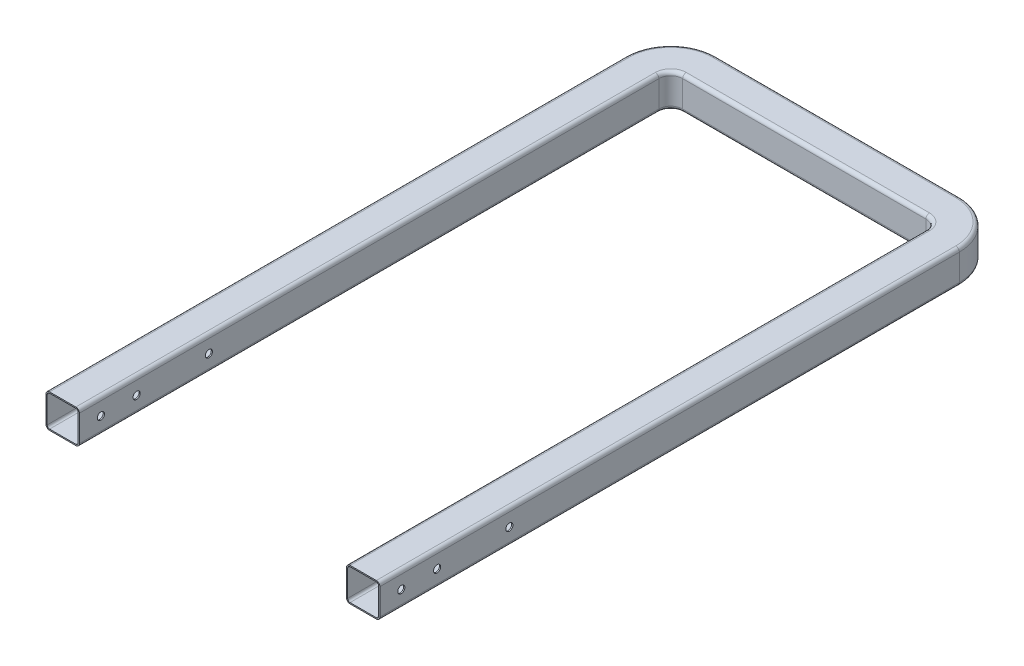
from build123d import *

# Parameters (mm, degrees)
CUT_EXTRUDE2_DEPTH      = 980.716626259
CUT_EXTRUDE2_DEPTH_BACK = 980.716626259
SKETCH4_R               = 5


with BuildPart() as part:
    # Sweep-Thin1: sweep along a path in Sketch1
    with BuildLine(Plane(origin=(0, 0, 0), x_dir=(1, 0, 0), z_dir=(0, 1, 0))) as sweep_thin1_path:
        Line((0, 0), (0, 810))
        ThreePointArc((0, 810), (11.715728753, 838.284271247), (40, 850))
        Line((40, 850), (380, 850))
        ThreePointArc((380, 850), (408.284271247, 838.284271247), (420, 810))
        Line((420, 810), (420, 0))
    # Sketch3 → Sweep-Thin1 (sweep)
    with BuildSketch(Plane.XY):
        with BuildLine():
            Line((18.35, 23.35), (-18.35, 23.35))
            ThreePointArc((-18.35, 23.35), (-21.885533906, 21.885533906), (-23.35, 18.35))
            Line((-23.35, 18.35), (-23.35, -18.35))
            ThreePointArc((-23.35, -18.35), (-21.885533906, -21.885533906), (-18.35, -23.35))
            Line((-18.35, -23.35), (18.35, -23.35))
            ThreePointArc((18.35, -23.35), (21.885533906, -21.885533906), (23.35, -18.35))
            Line((23.35, -18.35), (23.35, 18.35))
            ThreePointArc((23.35, 18.35), (21.885533906, 21.885533906), (18.35, 23.35))
        make_face()
        with BuildLine():
            Line((18.35, 21.7), (-18.35, 21.7))
            ThreePointArc((-18.35, 21.7), (-20.718807717, 20.718807717), (-21.7, 18.35))
            Line((-21.7, 18.35), (-21.7, -18.35))
            ThreePointArc((-21.7, -18.35), (-20.718807717, -20.718807717), (-18.35, -21.7))
            Line((-18.35, -21.7), (18.35, -21.7))
            ThreePointArc((18.35, -21.7), (20.718807717, -20.718807717), (21.7, -18.35))
            Line((21.7, -18.35), (21.7, 18.35))
            ThreePointArc((21.7, 18.35), (20.718807717, 20.718807717), (18.35, 21.7))
        make_face(mode=Mode.SUBTRACT)
    sweep(path=sweep_thin1_path.line)

    # Sketch4 → Cut-Extrude2 (cut, two sides: drawn at the far end of the back side and taken through both)
    with BuildSketch(Plane(origin=(0, 0, 0), x_dir=(0, 0, -1), z_dir=(1, 0, 0)).offset(-CUT_EXTRUDE2_DEPTH_BACK)):
        with Locations((30, 0)):
            Circle(SKETCH4_R)
        with Locations((80, 0)):
            Circle(SKETCH4_R)
        with Locations((180.955115779, 0)):
            Circle(SKETCH4_R)
    extrude(amount=CUT_EXTRUDE2_DEPTH + CUT_EXTRUDE2_DEPTH_BACK, mode=Mode.SUBTRACT)


solid = part.part
